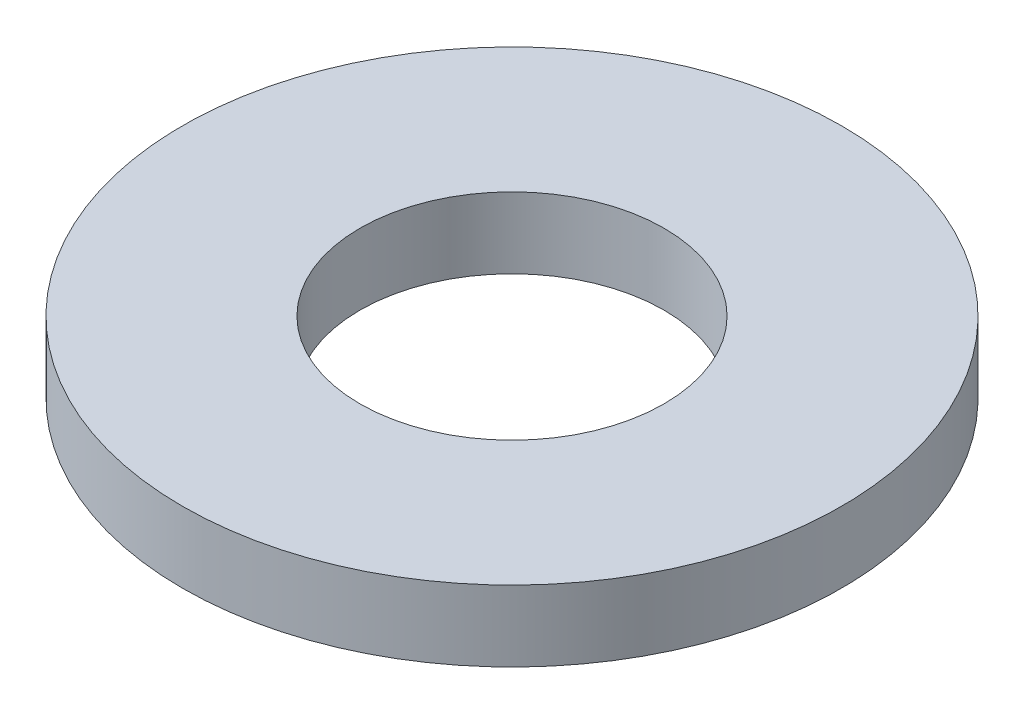
from build123d import *

# Parameters (mm, degrees)
SKETCH1_R           = 65
BOSS_EXTRUDE1_DEPTH = 14
SKETCH2_R           = 30
CUT_EXTRUDE1_DEPTH  = 93.983869569


with BuildPart() as part:
    # Sketch1 → Boss-Extrude1 (new body)
    with BuildSketch(Plane(origin=(0, 0, 0), x_dir=(1, 0, 0), z_dir=(0, 1, 0))):
        Circle(SKETCH1_R)
    extrude(amount=BOSS_EXTRUDE1_DEPTH)

    # Sketch2 → Cut-Extrude1 (cut, through all)
    with BuildSketch(Plane(origin=(0, 0, 0), x_dir=(1, 0, 0), z_dir=(0, 1, 0))):
        Circle(SKETCH2_R)
    extrude(amount=CUT_EXTRUDE1_DEPTH, mode=Mode.SUBTRACT)


solid = part.part
